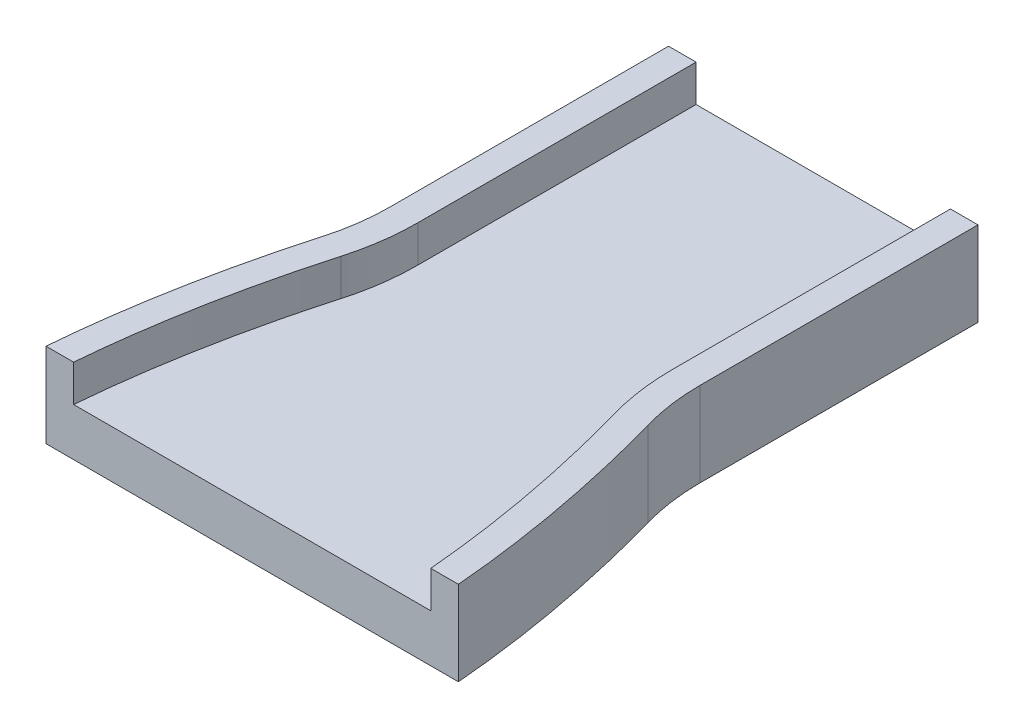
from build123d import *

# Parameters (mm, degrees)
SALIENTE_EXTRUIR1_DEPTH = 13
SALIENTE_EXTRUIR2_DEPTH = 10


with BuildPart() as part:
    # Croquis2 → Saliente-Extruir1 (new body)
    with BuildSketch(Plane(origin=(0, 0, 0), x_dir=(1, 0, 0), z_dir=(0, 1, 0))):
        with BuildLine():
            Line((-34.619878081, 80.997329636), (35.483623514, 80.997329636))
            Line((35.483623514, 80.997329636), (42.567401415, 80.997329636))
            Line((42.567401415, 80.997329636), (42.567401415, 5.272110763))
            ThreePointArc((42.567401415, 5.272110763), (43.139750829, -2.995557942), (44.845879609, -11.105493469))
            add(Edge.make_bspline(
                [(56.583236549, -74.519238889), (54.896993097, -53.897903416), (50.707396622, -31.763929057), (44.845879609, -11.105493469)],
                knots=[0, 0, 0, 0, 0.769012175, 0.769012175, 0.769012175, 0.769012175], degree=3))
            Line((56.583236549, -74.519238889), (50.414366394, -74.519238889))
            Line((50.414366394, -74.519238889), (-49.550620961, -74.519238889))
            Line((-49.550620961, -74.519238889), (-55.719491116, -74.519238889))
            add(Edge.make_bspline(
                [(-55.719491116, -74.519238889), (-54.033247664, -53.897903416), (-49.843651189, -31.763929057), (-43.982134176, -11.105493469)],
                knots=[0, 0, 0, 0, 0.769012175, 0.769012175, 0.769012175, 0.769012175], degree=3))
            ThreePointArc((-43.982134176, -11.105493469), (-42.276005396, -2.995557942), (-41.703655982, 5.272110763))
            Line((-41.703655982, 5.272110763), (-41.703655982, 80.997329636))
            Line((-41.703655982, 80.997329636), (-34.619878081, 80.997329636))
        make_face()
    extrude(amount=SALIENTE_EXTRUIR1_DEPTH)

    # Croquis3 → Saliente-Extruir2 (add)
    with BuildSketch(Plane(origin=(0, 13, 0), x_dir=(1, 0, 0), z_dir=(0, 1, 0))):
        with BuildLine():
            Line((-55.719491116, -74.519238889), (-48.193741573, -74.519238889))
            add(Edge.make_bspline(
                [(-36.76694395, -13.152693998), (-39.633790517, -23.256659406), (-42.095465469, -33.737036473), (-45.951455187, -54.448538495), (-47.366236617, -64.68124853), (-48.193741573, -74.519238889)],
                knots=[0, 0, 0, 0, 0.5, 0.5, 0.989846548, 0.989846548, 0.989846548, 0.989846548], degree=3))
            ThreePointArc((-36.76694395, -13.152693998), (-34.847549073, -4.02901653), (-34.203655982, 5.272110763))
            Line((-34.203655982, 5.272110763), (-34.203655982, 80.997329636))
            Line((-34.203655982, 80.997329636), (-41.703655982, 80.997329636))
            Line((-41.703655982, 80.997329636), (-41.703655982, 5.272110763))
            ThreePointArc((-41.703655982, 5.272110763), (-42.276005396, -2.995557942), (-43.982134176, -11.105493469))
            add(Edge.make_bspline(
                [(-55.719491116, -74.519238889), (-54.033247664, -53.897903416), (-49.843651189, -31.763929057), (-43.982134176, -11.105493469)],
                knots=[0, 0, 0, 0, 0.769012175, 0.769012175, 0.769012175, 0.769012175], degree=3))
        make_face()
        with BuildLine():
            Line((56.583236549, -74.519238889), (49.057487006, -74.519238889))
            add(Edge.make_bspline(
                [(37.630689383, -13.152693998), (40.49753595, -23.256659406), (42.959210902, -33.737036473), (46.81520062, -54.448538495), (48.229982049, -64.68124853), (49.057487006, -74.519238889)],
                knots=[0, 0, 0, 0, 0.5, 0.5, 0.989846548, 0.989846548, 0.989846548, 0.989846548], degree=3))
            ThreePointArc((37.630689383, -13.152693998), (35.711294506, -4.02901653), (35.067401415, 5.272110763))
            Line((35.067401415, 5.272110763), (35.067401415, 80.997329636))
            Line((35.067401415, 80.997329636), (42.567401415, 80.997329636))
            Line((42.567401415, 80.997329636), (42.567401415, 5.272110763))
            ThreePointArc((42.567401415, 5.272110763), (43.139750829, -2.995557942), (44.845879609, -11.105493469))
            add(Edge.make_bspline(
                [(56.583236549, -74.519238889), (54.896993097, -53.897903416), (50.707396622, -31.763929057), (44.845879609, -11.105493469)],
                knots=[0, 0, 0, 0, 0.769012175, 0.769012175, 0.769012175, 0.769012175], degree=3))
        make_face()
    extrude(amount=SALIENTE_EXTRUIR2_DEPTH)


solid = part.part
